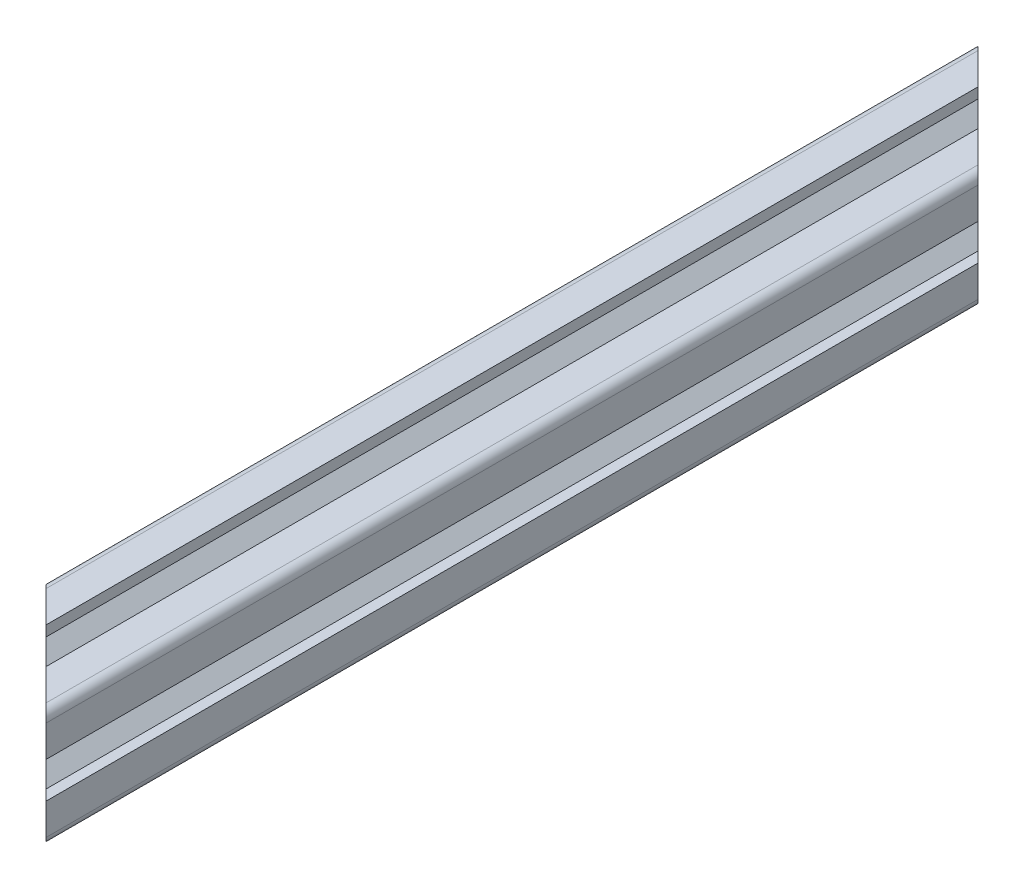
from build123d import *

# Parameters (mm, degrees)
SKETCH_1_R          = 2.5
EXTRUDE_1_DEPTH     = 180
CUT_EXTRUDE_1_DEPTH = 182.383571472


with BuildPart() as part:
    # 草图1 → 凸台-拉伸1 (new body)
    with BuildSketch(Plane.XY):
        with BuildLine():
            Line((-8.2, -3.1), (-10, -3.1))
            Line((-10, -3.1), (-10, -8.5))
            ThreePointArc((-10, -8.5), (-9.560660172, -9.560660172), (-8.5, -10))
            Line((-8.5, -10), (-3.1, -10))
            Line((-3.1, -10), (-3.1, -8.2))
            Line((-3.1, -8.2), (-5.5, -8.2))
            Line((-5.5, -8.2), (-5.5, -6.397050155))
            Line((-5.5, -6.397050155), (-2.202949845, -3.1))
            Line((-2.202949845, -3.1), (2.202949845, -3.1))
            Line((2.202949845, -3.1), (5.5, -6.397050155))
            Line((5.5, -6.397050155), (5.5, -8.2))
            Line((5.5, -8.2), (3.1, -8.2))
            Line((3.1, -8.2), (3.1, -10))
            Line((3.1, -10), (8.5, -10))
            ThreePointArc((8.5, -10), (9.560660172, -9.560660172), (10, -8.5))
            Line((10, -8.5), (10, -3.1))
            Line((10, -3.1), (8.2, -3.1))
            Line((8.2, -3.1), (8.2, -5.5))
            Line((8.2, -5.5), (6.397050155, -5.5))
            Line((6.397050155, -5.5), (3.05412702, -2.157076865))
            Line((3.05412702, -2.157076865), (3.05412702, 2.157076865))
            Line((3.05412702, 2.157076865), (6.397050155, 5.5))
            Line((6.397050155, 5.5), (8.2, 5.5))
            Line((8.2, 5.5), (8.2, 3.1))
            Line((8.2, 3.1), (10, 3.1))
            Line((10, 3.1), (10, 8.5))
            ThreePointArc((10, 8.5), (9.560660172, 9.560660172), (8.5, 10))
            Line((8.5, 10), (3.1, 10))
            Line((3.1, 10), (3.1, 8.2))
            Line((3.1, 8.2), (5.5, 8.2))
            Line((5.5, 8.2), (5.5, 6.397050155))
            Line((5.5, 6.397050155), (2.202949845, 3.1))
            Line((2.202949845, 3.1), (-2.202949845, 3.1))
            Line((-2.202949845, 3.1), (-5.5, 6.397050155))
            Line((-5.5, 6.397050155), (-5.5, 8.2))
            Line((-5.5, 8.2), (-3.1, 8.2))
            Line((-3.1, 8.2), (-3.1, 10))
            Line((-3.1, 10), (-8.5, 10))
            ThreePointArc((-8.5, 10), (-9.560660172, 9.560660172), (-10, 8.5))
            Line((-10, 8.5), (-10, 3.1))
            Line((-10, 3.1), (-8.2, 3.1))
            Line((-8.2, 3.1), (-8.2, 5.5))
            Line((-8.2, 5.5), (-6.397050155, 5.5))
            Line((-6.397050155, 5.5), (-3.05412702, 2.157076865))
            Line((-3.05412702, 2.157076865), (-3.05412702, -2.157076865))
            Line((-3.05412702, -2.157076865), (-6.397050155, -5.5))
            Line((-6.397050155, -5.5), (-8.2, -5.5))
            Line((-8.2, -5.5), (-8.2, -3.1))
        make_face()
        Circle(SKETCH_1_R, mode=Mode.SUBTRACT)
    extrude(amount=EXTRUDE_1_DEPTH)

    # 草图2 → 切除-拉伸1 (cut, through all)
    with BuildSketch(Plane(origin=(0, 10, 0), x_dir=(1, 0, 0), z_dir=(0, 1, 0))):
        Polygon((-10, 0), (10, 0), (10, -20), align=None)
        Polygon((-10, -180), (-10, -160), (10, -180), align=None)
    extrude(amount=-CUT_EXTRUDE_1_DEPTH, mode=Mode.SUBTRACT)


solid = part.part
